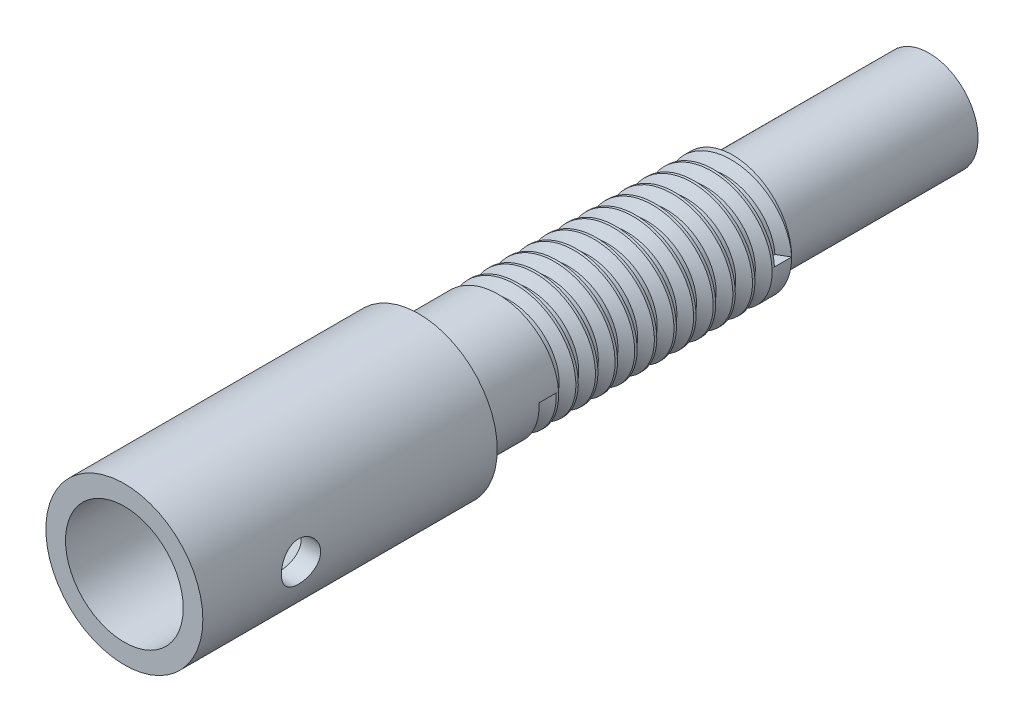
from build123d import *

# Parameters (mm, degrees)
SKETCH1_R               = 4
BOSS_EXTRUDE1_DEPTH     = 41
SKETCH2_R               = 3
CUT_EXTRUDE1_DEPTH      = 10
CHAMFER3_SIZE           = 0.5
CUT_EXTRUDE3_DEPTH      = 10
CUT_EXTRUDE3_DEPTH_BACK = 10
SKETCH8_R               = 1
SKETCH9_R               = 4
SKETCH9_R_2             = 3
CUT_EXTRUDE4_DEPTH      = 50
CHAMFER4_SIZE           = 0.5
CUT_EXTRUDE5_START      = -10
SKETCH11_R              = 3
SKETCH11_R_2            = 2.5
CUT_EXTRUDE5_DEPTH      = 10
THREAD1_PITCH           = 1


with BuildPart() as part:
    # Sketch1 → Boss-Extrude1 (new body)
    with BuildSketch(Plane.XY):
        Circle(SKETCH1_R)
    extrude(amount=BOSS_EXTRUDE1_DEPTH)

    # Sketch2 → Cut-Extrude1 (cut)
    with BuildSketch(Plane.XY.offset(41)):
        Circle(SKETCH2_R)
    extrude(amount=-CUT_EXTRUDE1_DEPTH, mode=Mode.SUBTRACT)

    # Chamfer3
    chamfer3_edges = [part.edges().sort_by_distance(p)[0] for p in [
        (-4, 0, 0),
    ]]
    chamfer(chamfer3_edges, length=CHAMFER3_SIZE)

    # Sketch8 → Cut-Extrude3 (cut, two sides: drawn at the far end of the back side and taken through both)
    with BuildSketch(Plane(origin=(0, 0, 0), x_dir=(0, 0, -1), z_dir=(1, 0, 0)).offset(-CUT_EXTRUDE3_DEPTH_BACK)):
        with Locations(Location((-36, 0, 0), (0, 0, 180))):
            Circle(SKETCH8_R)
    extrude(amount=CUT_EXTRUDE3_DEPTH + CUT_EXTRUDE3_DEPTH_BACK, mode=Mode.SUBTRACT)

    # Sketch9 → Cut-Extrude4 (cut)
    with BuildSketch(Plane.XY.offset(26)):
        Circle(SKETCH9_R)
        Circle(SKETCH9_R_2, mode=Mode.SUBTRACT)
    extrude(amount=-CUT_EXTRUDE4_DEPTH, mode=Mode.SUBTRACT)

    # Chamfer4
    chamfer4_edges = [part.edges().sort_by_distance(p)[0] for p in [
        (-3, 0, 0),
    ]]
    chamfer(chamfer4_edges, length=CHAMFER4_SIZE)

    # Sketch11 → Cut-Extrude5 (cut)
    with BuildSketch(Plane(origin=(0, 0, 0), x_dir=(-1, 0, 0), z_dir=(0, 0, -1)).offset(CUT_EXTRUDE5_START)):
        with Locations(Location((0, 0, 0), (0, 0, 180))):
            Circle(SKETCH11_R)
        Circle(SKETCH11_R_2, mode=Mode.SUBTRACT)
    extrude(amount=CUT_EXTRUDE5_DEPTH, mode=Mode.SUBTRACT)

    # Thread1: the profile of Thread Profile1 profile screwed along a right-hand helix of 12 turns, 8 arcs to a turn; built about Z, then put on its axis
    thread1_z = Axis((0, 0, 0), (0, 0, 1))
    thread1_corners = [(3.0003, 0, -0.000173205), (3.0003, 0, 0.875173202), (2.458734125, 0, 0.562499999), (2.458734125, 0, 0.312499999)]
    with BuildLine(mode=Mode.PRIVATE) as thread1_profile:
        Line(thread1_corners[0], thread1_corners[1])
        Line(thread1_corners[1], thread1_corners[2])
        Line(thread1_corners[2], thread1_corners[3])
        Line(thread1_corners[3], thread1_corners[0])
    thread1_cap = Face(thread1_profile.wire())
    thread1_turn_angles = [0, 22.5, 45, 67.5, 90, 112.5, 135, 157.5, 180, 202.5, 225, 247.5, 270, 292.5, 315, 337.5, 360]
    thread1_turn_weights = [1, 0.9238795325112867, 1, 0.9238795325112867, 1, 0.9238795325112867, 1, 0.9238795325112867, 1, 0.9238795325112867, 1, 0.9238795325112867, 1, 0.9238795325112867, 1, 0.9238795325112867, 1]
    thread1_turn_rails = [Edge.make_bspline([Vector(p[0], p[1], 0).rotate(thread1_z, thread1_turn_angles[k]) / thread1_turn_weights[k] + Vector(0, 0, p[2] + THREAD1_PITCH * thread1_turn_angles[k] / 360) for k in range(17)], [0, 0, 0, 1, 1, 2, 2, 3, 3, 4, 4, 5, 5, 6, 6, 7, 7, 8, 8, 8], 2, thread1_turn_weights) for p in thread1_corners]
    thread1_turn_sides = [Face.make_surface_from_curves(thread1_turn_rails[p[0]], thread1_turn_rails[p[1]]) for p in [(0, 1), (1, 2), (2, 3), (3, 0)]]
    thread1 = Plane(origin=(0, 0, 10), x_dir=(1, 0, 0), z_dir=(0, 0, 1)) * Solid(Shell([*[p.moved(Location((0, 0, THREAD1_PITCH * i))) for i in range(12) for p in thread1_turn_sides], thread1_cap, thread1_cap.rotate(thread1_z, 4320).moved(Location((0, 0, THREAD1_PITCH * 4320 / 360)))]))
    add(thread1, mode=Mode.SUBTRACT)


solid = part.part
